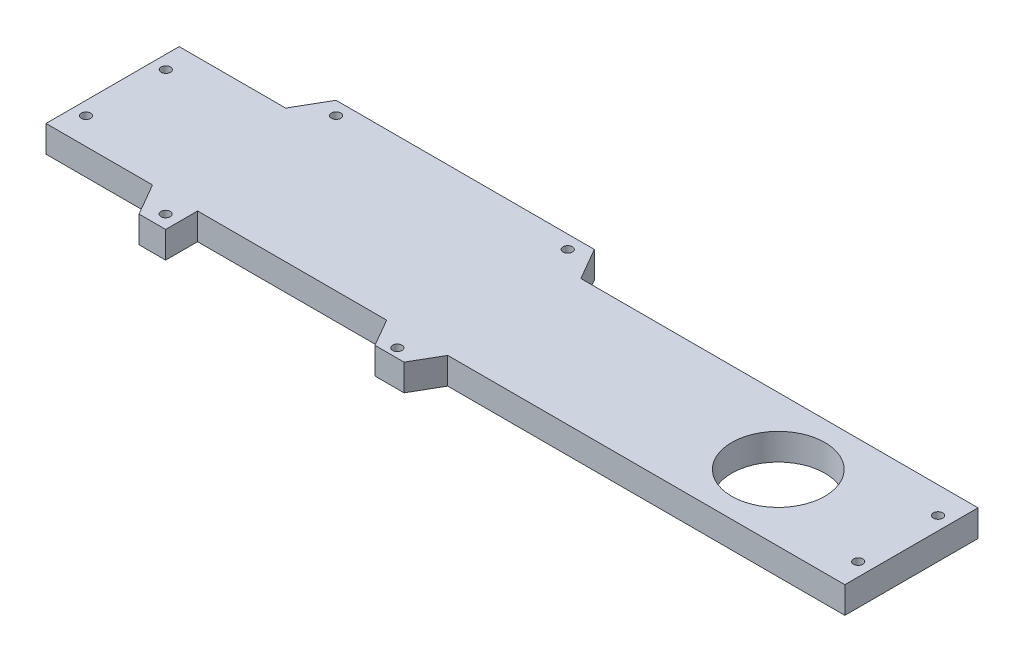
from build123d import *

# Parameters (mm, degrees)
SKETCH1_R           = 1.75
SKETCH1_R_2         = 17.5
BOSS_EXTRUDE1_DEPTH = 10


with BuildPart() as part:
    # Sketch1 → Boss-Extrude1 (new body)
    with BuildSketch(Plane(origin=(0, 0, 0), x_dir=(1, 0, 0), z_dir=(0, 1, 0))):
        Polygon((40, 50), (46.92820323, 62), (143.92820323, 62), (150.856406461, 50), (300, 50), (300, 0), (150.856406461, 0), (144.856406461, -10.392304845), (133.92820323, -10.392304845), (127.92820323, 0), (56.92820323, 0), (56.92820323, -12), (46.92820323, -12), (40, 0), (0, 0), (0, 50), align=None)
        with Locations((5, 40)):
            Circle(SKETCH1_R, mode=Mode.SUBTRACT)
        with Locations((5, 10)):
            Circle(SKETCH1_R, mode=Mode.SUBTRACT)
        with Locations((295, 10)):
            Circle(SKETCH1_R, mode=Mode.SUBTRACT)
        with Locations((295, 40)):
            Circle(SKETCH1_R, mode=Mode.SUBTRACT)
        with Locations((51.92820323, 57)):
            Circle(SKETCH1_R, mode=Mode.SUBTRACT)
        with Locations((138.92820323, 57)):
            Circle(SKETCH1_R, mode=Mode.SUBTRACT)
        with Locations((138.92820323, -7)):
            Circle(SKETCH1_R, mode=Mode.SUBTRACT)
        with Locations((51.92820323, -7)):
            Circle(SKETCH1_R, mode=Mode.SUBTRACT)
        with Locations((250, 25)):
            Circle(SKETCH1_R_2, mode=Mode.SUBTRACT)
    extrude(amount=BOSS_EXTRUDE1_DEPTH)


solid = part.part
